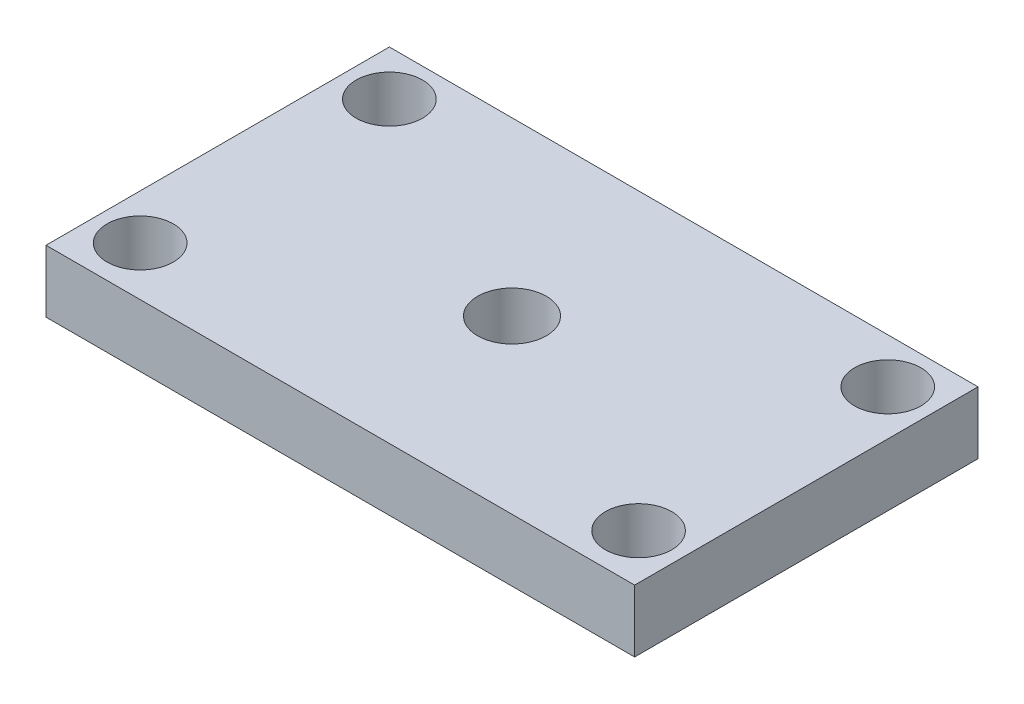
from build123d import *

# Parameters (mm, degrees)
SKETCH1_W           = 60
SKETCH1_H           = 35
SKETCH1_R           = 3.3782
SKETCH1_R_2         = 3.5
BOSS_EXTRUDE1_DEPTH = 6.35


with BuildPart() as part:
    # Sketch1 → Boss-Extrude1 (new body)
    with BuildSketch(Plane(origin=(0, 0, 0), x_dir=(1, 0, 0), z_dir=(0, 1, 0))):
        with Locations((30, 17.5)):
            Rectangle(SKETCH1_W, SKETCH1_H)
        with Locations((4.6, 30.4)):
            Circle(SKETCH1_R, mode=Mode.SUBTRACT)
        with Locations((55.4, 30.4)):
            Circle(SKETCH1_R, mode=Mode.SUBTRACT)
        with Locations((4.6, 5)):
            Circle(SKETCH1_R, mode=Mode.SUBTRACT)
        with Locations((55.4, 5)):
            Circle(SKETCH1_R, mode=Mode.SUBTRACT)
        with Locations((30, 17.5)):
            Circle(SKETCH1_R_2, mode=Mode.SUBTRACT)
    extrude(amount=BOSS_EXTRUDE1_DEPTH)


solid = part.part
